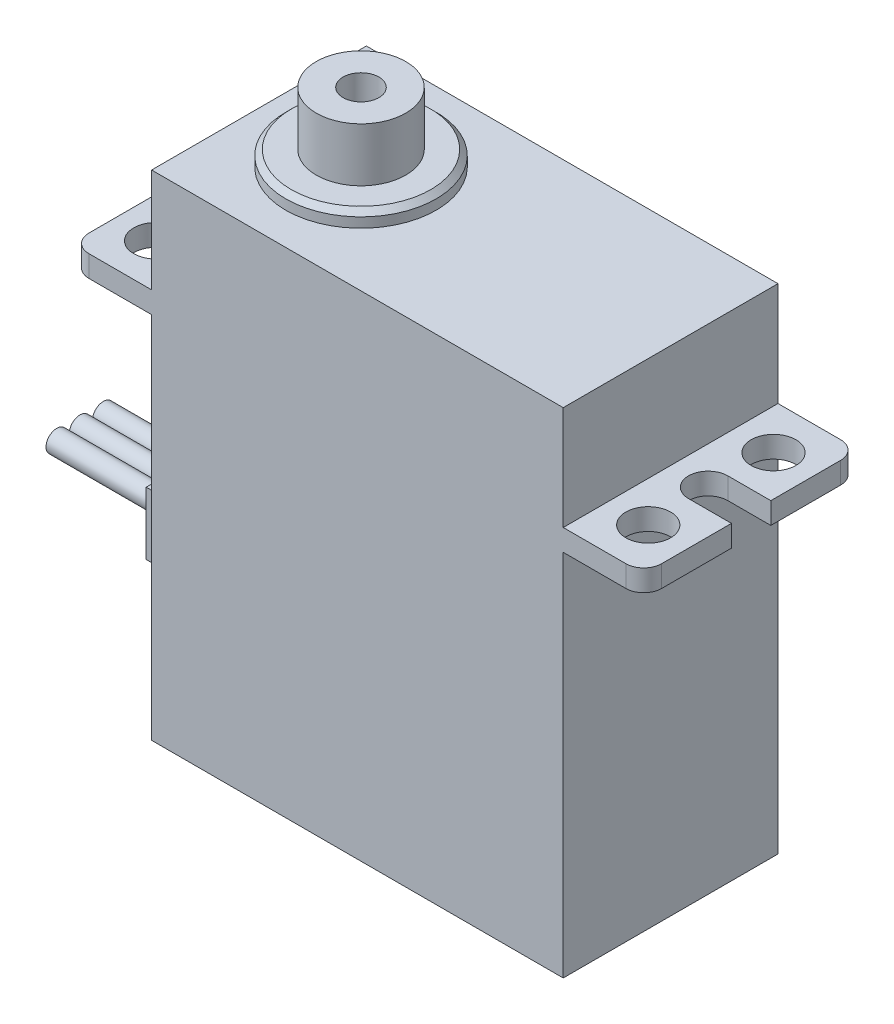
from build123d import *

# Parameters (mm, degrees)
EXTRUDE_1_DEPTH          = 6
SKETCH_2_R               = 4.2
EXTRUDE_2_DEPTH          = 0.85
CHAMFER_1_SIZE           = 0.3
SKETCH_4_R               = 2.5
SKETCH_4_R_2             = 1
EXTRUDE_3_DEPTH          = 3
CUT_EXTRUDE_1_DEPTH      = 28.699097458
CUT_EXTRUDE_1_DEPTH_BACK = 28.699097458
SKETCH_3_R               = 1.25
FILLET_1_R               = 1
SKETCH_5_W               = 5.6
SKETCH_5_H               = 3.5
EXTRUDE_4_DEPTH          = 3.5
SKETCH_6_R               = 0.6
EXTRUDE_7_DEPTH          = 6.5


with BuildPart() as part:
    # Эскиз1 → Бобышка-Вытянуть1 (new, symmetric)
    with BuildSketch(Plane.XY):
        Polygon((-11.5, 6.8), (-11.5, -13.8), (11.5, -13.8), (11.5, 6.8), (16, 6.8), (16, 8), (11.5, 8), (11.5, 13.8), (-11.5, 13.8), (-11.5, 8), (-16, 8), (-16, 6.8), align=None)
    extrude(amount=EXTRUDE_1_DEPTH, both=True)

    # Эскиз2 → Бобышка-Вытянуть2 (add)
    with BuildSketch(Plane(origin=(0, 13.8, 0), x_dir=(1, 0, 0), z_dir=(0, 1, 0))):
        with Locations((-5.8, 0)):
            Circle(SKETCH_2_R)
    extrude(amount=EXTRUDE_2_DEPTH)

    # Фаска1
    chamfer_1_edges = [part.edges().sort_by_distance(p)[0] for p in [
        (-10, 14.65, 0),
    ]]
    chamfer(chamfer_1_edges, length=CHAMFER_1_SIZE)

    # Эскиз4 → Бобышка-Вытянуть3 (add)
    with BuildSketch(Plane(origin=(0, 14.65, 0), x_dir=(1, 0, 0), z_dir=(0, 1, 0))):
        with Locations((-5.8, 0)):
            Circle(SKETCH_4_R)
        with Locations((-5.8, 0)):
            Circle(SKETCH_4_R_2, mode=Mode.SUBTRACT)
    extrude(amount=EXTRUDE_3_DEPTH)

    # Эскиз3 → Вырез-Вытянуть1 (cut, two sides: drawn at the far end of the back side and taken through both)
    with BuildSketch(Plane(origin=(0, 8, 0), x_dir=(1, 0, 0), z_dir=(0, 1, 0)).offset(-CUT_EXTRUDE_1_DEPTH_BACK)):
        with Locations((-13.75, 3.5)):
            Circle(SKETCH_3_R)
        with Locations((-13.75, -3.5)):
            Circle(SKETCH_3_R)
        with Locations((13.75, -3.5)):
            Circle(SKETCH_3_R)
        with Locations((13.75, 3.5)):
            Circle(SKETCH_3_R)
        with BuildLine():
            Line((-16, 1.1), (-13.6, 1.1))
            ThreePointArc((-13.6, 1.1), (-12.5, 0), (-13.6, -1.1))
            Line((-13.6, -1.1), (-16, -1.1))
            Line((-16, -1.1), (-16, 1.1))
        make_face()
        with BuildLine():
            Line((16, 1.1), (13.6, 1.1))
            ThreePointArc((13.6, 1.1), (12.5, 0), (13.6, -1.1))
            Line((13.6, -1.1), (16, -1.1))
            Line((16, -1.1), (16, 1.1))
        make_face()
    extrude(amount=CUT_EXTRUDE_1_DEPTH + CUT_EXTRUDE_1_DEPTH_BACK, mode=Mode.SUBTRACT)

    # Скругление1
    fillet_1_edges = [part.edges().sort_by_distance(p)[0] for p in [
        (-16, 7.4, -6),
        (16, 7.4, -6),
        (16, 7.4, 6),
        (-16, 7.4, 6),
    ]]
    fillet(fillet_1_edges, radius=FILLET_1_R)

    # Эскиз5 → Бобышка-Вытянуть4 (add)
    with BuildSketch(Plane.ZY.offset(11.5)):
        with Locations((0, -6.65)):
            Rectangle(SKETCH_5_W, SKETCH_5_H)
    extrude(amount=EXTRUDE_4_DEPTH)

    # Эскиз6 → Бобышка-Вытянуть7 (add)
    with BuildSketch(Plane.ZY.offset(15)):
        with Locations((0, -6.65)):
            Circle(SKETCH_6_R)
        with Locations((1.3, -6.65)):
            Circle(SKETCH_6_R)
        with Locations((-1.3, -6.65)):
            Circle(SKETCH_6_R)
    extrude(amount=EXTRUDE_7_DEPTH)


solid = part.part
